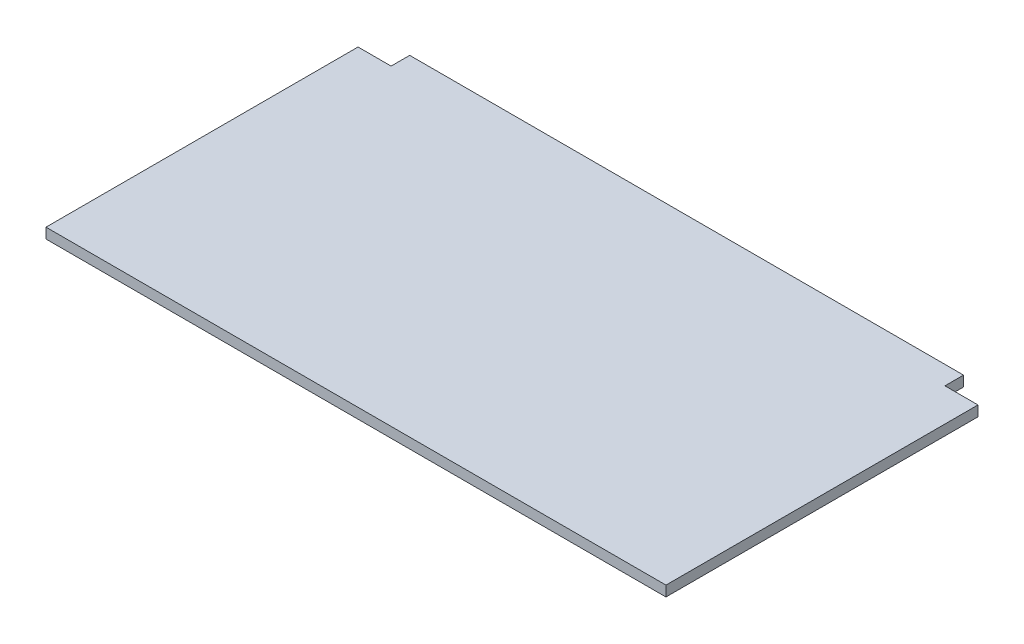
from build123d import *

# Parameters (mm, degrees)
SKETCH1_W           = 1500
SKETCH1_H           = 800
RAWMATERIAL_DEPTH   = 25
SKETCH2_W           = 80
SKETCH2_H           = 45
SLOTSFORFRAME_DEPTH = 851.367567585


with BuildPart() as part:
    # Sketch1 → RawMaterial (new body)
    with BuildSketch(Plane(origin=(0, 0, 0), x_dir=(1, 0, 0), z_dir=(0, 1, 0))):
        Rectangle(SKETCH1_W, SKETCH1_H)
    extrude(amount=RAWMATERIAL_DEPTH)

    # Sketch2 → SlotsForFrame (cut, through all)
    with BuildSketch(Plane(origin=(0, 25, 0), x_dir=(1, 0, 0), z_dir=(0, 1, 0))):
        with Locations((710, 377.5)):
            Rectangle(SKETCH2_W, SKETCH2_H)
        with Locations((-710, 377.5)):
            Rectangle(SKETCH2_W, SKETCH2_H)
    extrude(amount=-SLOTSFORFRAME_DEPTH, mode=Mode.SUBTRACT)


solid = part.part
